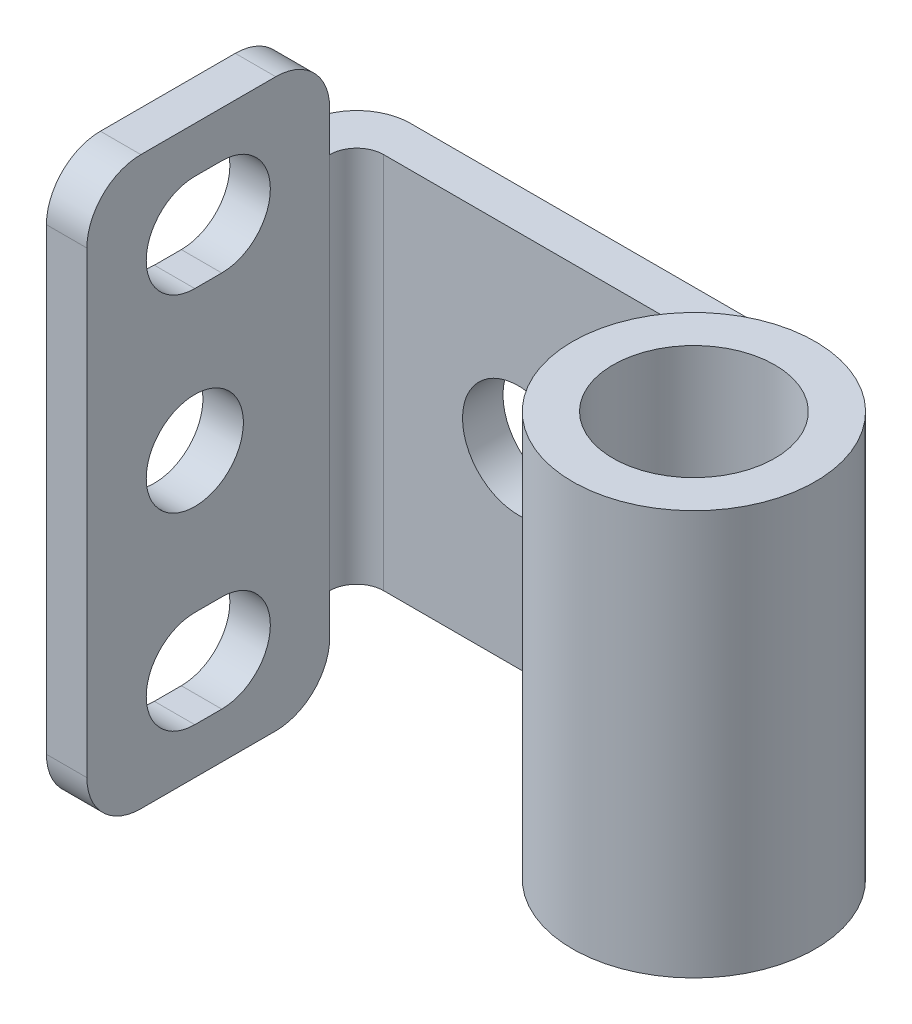
from build123d import *

# Parameters (mm, degrees)
SKETCH_1_W             = 11
SKETCH_1_H             = 14
SM_BASE_FLANGE_1_DEPTH = 1.5
SKETCH_9_R             = 4.5
SKETCH_9_R_2           = 3
EXTRUDE_1_DEPTH        = 15
SKETCH_10_W            = 1.5
SKETCH_10_H            = 14
EXTRUDE_1_2_DEPTH      = 4.5
SKETCH_11_W            = 1.5
SKETCH_11_H            = 14
EXTRUDE_2_DEPTH        = 11.5
FILLET_2_R             = 2
FILLET_3_R             = 1
SKETCH_12_W            = 9
SKETCH_12_H            = 3.5
EXTRUDE_3_DEPTH        = 1.5
FILLET_4_R             = 2
SKETCH_13_R            = 1.8
CUT_EXTRUDE_1_DEPTH    = 1.5
SKETCH_14_R            = 2.076590198
CUT_EXTRUDE_2_DEPTH    = 1.5


# Sheet-metal steps are written as plain solids
with BuildPart() as part:
    # Sketch 1 → Базовая кромка1 (new body)
    with BuildSketch(Plane.XY):
        with Locations((5.5, -7)):
            Rectangle(SKETCH_1_W, SKETCH_1_H)
    extrude(amount=-SM_BASE_FLANGE_1_DEPTH)



with BuildPart() as body_2:
    # Эскиз9 → Extrude 1 (new body)
    with BuildSketch(Plane(origin=(0, -14.5, 0), x_dir=(-1, 0, 0), z_dir=(0, -1, 0))):
        with Locations((-15.5, -3)):
            Circle(SKETCH_9_R)
        with Locations((-15.5, -3)):
            Circle(SKETCH_9_R_2, mode=Mode.SUBTRACT)
    extrude(amount=-EXTRUDE_1_DEPTH)


with BuildPart() as part_1:
    add(part.part)

    add(body_2.part)  # Extrude 1 2 merges body 2
    # Эскиз10 → Extrude 1 2 (add)
    with BuildSketch(Plane(origin=(11, 0, 0), x_dir=(0, 0, -1), z_dir=(1, 0, 0))):
        with Locations((0.75, -7)):
            Rectangle(SKETCH_10_W, SKETCH_10_H)
    extrude(amount=EXTRUDE_1_2_DEPTH)

    # Эскиз11 → Бобышка-Вытянуть2 (add)
    with BuildSketch(Plane(origin=(0, 0, -1.5), x_dir=(-1, 0, 0), z_dir=(0, 0, -1))):
        with Locations((0.75, -7)):
            Rectangle(SKETCH_11_W, SKETCH_11_H)
    extrude(amount=-EXTRUDE_2_DEPTH)

    # Скругление2
    fillet_2_edges = [part_1.edges().sort_by_distance(p)[0] for p in [
        (-1.5, -7, -1.5),
    ]]
    fillet(fillet_2_edges, radius=FILLET_2_R)

    # Скругление3
    fillet_3_edges = [part_1.edges().sort_by_distance(p)[0] for p in [
        (0, -7, 0),
    ]]
    fillet(fillet_3_edges, radius=FILLET_3_R)

    # Эскиз12 → Бобышка-Вытянуть3 (add)
    with BuildSketch(Plane.ZY.offset(1.5)):
        with Locations((5.5, -15.75)):
            Rectangle(SKETCH_12_W, SKETCH_12_H)
        with Locations((5.5, 1.75)):
            Rectangle(SKETCH_12_W, SKETCH_12_H)
    extrude(amount=-EXTRUDE_3_DEPTH)

    # Скругление4
    fillet_4_edges = [part_1.edges().sort_by_distance(p)[0] for p in [
        (-0.75, -17.5, 10),
        (-0.75, -17.5, 1),
        (-0.75, 3.5, 10),
        (-0.75, 3.5, 1),
    ]]
    fillet(fillet_4_edges, radius=FILLET_4_R)

    # Эскиз13 → Вырез-Вытянуть1 (cut)
    with BuildSketch(Plane.ZY.offset(1.5)):
        with Locations((6, -7)):
            Circle(SKETCH_13_R)
        with BuildLine():
            Line((5, 1.8), (6, 1.8))
            ThreePointArc((6, 1.8), (7.8, 0), (6, -1.8))
            Line((6, -1.8), (5, -1.8))
            ThreePointArc((5, -1.8), (3.2, 0), (5, 1.8))
        make_face()
        with BuildLine():
            Line((5, -15.8), (6, -15.8))
            ThreePointArc((6, -15.8), (7.8, -14), (6, -12.2))
            Line((6, -12.2), (5, -12.2))
            ThreePointArc((5, -12.2), (3.2, -14), (5, -15.8))
        make_face()
    extrude(amount=-CUT_EXTRUDE_1_DEPTH, mode=Mode.SUBTRACT)

    # Эскиз14 → Вырез-Вытянуть2 (cut)
    with BuildSketch(Plane(origin=(0, 0, -1.5), x_dir=(-1, 0, 0), z_dir=(0, 0, -1))):
        with Locations((-6, -7)):
            Circle(SKETCH_14_R)
    extrude(amount=-CUT_EXTRUDE_2_DEPTH, mode=Mode.SUBTRACT)


solid = part_1.part
